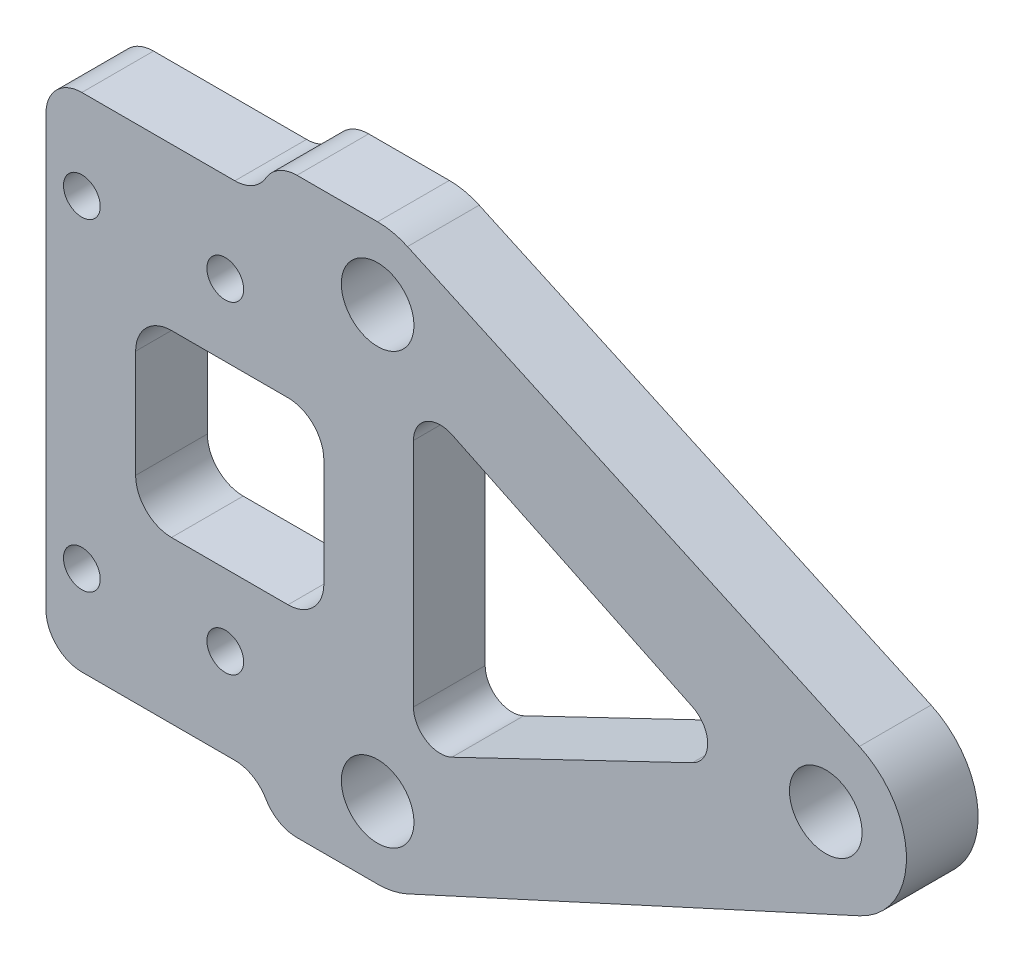
from build123d import *

# Parameters (mm, degrees)
SKETCH_1_W          = 48
SKETCH_1_H          = 32
EXTRUDE_1_DEPTH     = 4
SKETCH_2_R          = 2.025
SKETCH_2_R_2        = 1.025
CUT_EXTRUDE_1_DEPTH = 30.8
CUT_EXTRUDE_2_DEPTH = 10
SKETCH_5_W          = 12
SKETCH_5_H          = 2
CUT_EXTRUDE_3_DEPTH = 10
FILLET_1_R          = 2
CUT_EXTRUDE_4_DEPTH = 10
FILLET_2_R          = 1.5
SKETCH_7_W          = 10.5
SKETCH_7_H          = 10
CUT_EXTRUDE_5_DEPTH = 10
FILLET_3_R          = 2


with BuildPart() as part:
    # 草图1 → 凸台-拉伸1 (new body)
    with BuildSketch(Plane.XY):
        Rectangle(SKETCH_1_W, SKETCH_1_H)
    extrude(amount=EXTRUDE_1_DEPTH)

    # 草图2 → 切除-拉伸1 (cut)
    with BuildSketch(Plane(origin=(0, 0, 0), x_dir=(-1, 0, 0), z_dir=(0, 0, -1))):
        with Locations((-19.5, 0)):
            Circle(SKETCH_2_R)
        with Locations((5.5, -12)):
            Circle(SKETCH_2_R)
        with Locations((5.5, 12)):
            Circle(SKETCH_2_R)
        with Locations((14, -9)):
            Circle(SKETCH_2_R_2)
        with Locations((22, -9)):
            Circle(SKETCH_2_R_2)
    cut_extrude_1 = extrude(amount=-CUT_EXTRUDE_1_DEPTH, mode=Mode.SUBTRACT)

    # 草图4 → 切除-拉伸2 (cut)
    with BuildSketch(Plane(origin=(0, 0, 0), x_dir=(-1, 0, 0), z_dir=(0, 0, -1))):
        with BuildLine():
            Line((-21.373826305, 4.091304802), (3.834376618, 15.636715379))
            ThreePointArc((3.834376618, 15.636715379), (4.647609689, 15.908123688), (5.5, 16))
            Line((5.5, 16), (-24, 16))
            Line((-24, 16), (-24, 0))
            ThreePointArc((-24, 0), (-23.286965696, 2.430821017), (-21.373826305, 4.091304802))
        make_face()
    cut_extrude_2 = extrude(amount=-CUT_EXTRUDE_2_DEPTH, mode=Mode.SUBTRACT)

    # 镜向1: 切除-拉伸2 across plane
    add(cut_extrude_2.mirror(Plane.ZX), mode=Mode.SUBTRACT)

    # 草图5 → 切除-拉伸3 (cut)
    with BuildSketch(Plane(origin=(0, 0, 0), x_dir=(-1, 0, 0), z_dir=(0, 0, -1))):
        with Locations((18, -15)):
            Rectangle(SKETCH_5_W, SKETCH_5_H)
        with Locations((18, 15)):
            Rectangle(SKETCH_5_W, SKETCH_5_H)
    extrude(amount=-CUT_EXTRUDE_3_DEPTH, mode=Mode.SUBTRACT)

    # 圆角1
    fillet_1_edges = [part.edges().sort_by_distance(p)[0] for p in [
        (-24, -14, 2),
        (-24, 14, 2),
        (-12, -16, 2),
        (-12, 16, 2),
    ]]
    fillet(fillet_1_edges, radius=FILLET_1_R - 0.0001)  # a hair under: the kernel refuses the full size

    # 草图6 → 切除-拉伸4 (cut)
    with BuildSketch(Plane(origin=(0, 0, 0), x_dir=(-1, 0, 0), z_dir=(0, 0, -1))):
        Polygon((3.5, 8.82153206), (-14.878191792, 0), (3.5, -8.82153206), align=None)
    extrude(amount=-CUT_EXTRUDE_4_DEPTH, mode=Mode.SUBTRACT)

    # 圆角2
    fillet_2_edges = [part.edges().sort_by_distance(p)[0] for p in [
        (-3.5, 8.82153206, 2),
        (-3.5, -8.82153206, 2),
        (14.878191792, 0, 2),
    ]]
    fillet(fillet_2_edges, radius=FILLET_2_R)

    # 镜向2: 切除-拉伸1 across plane
    add(cut_extrude_1.mirror(Plane.ZX), mode=Mode.SUBTRACT)

    # 草图7 → 切除-拉伸5 (cut)
    with BuildSketch(Plane(origin=(0, 0, 0), x_dir=(-1, 0, 0), z_dir=(0, 0, -1))):
        with Locations((13.75, 0)):
            Rectangle(SKETCH_7_W, SKETCH_7_H)
    extrude(amount=-CUT_EXTRUDE_5_DEPTH, mode=Mode.SUBTRACT)

    # 圆角3
    fillet_3_edges = [part.edges().sort_by_distance(p)[0] for p in [
        (-19, 5, 2),
        (-19, -5, 2),
        (-8.5, -5, 2),
        (-8.5, 5, 2),
        (-12, -14, 2),
        (-12, 14, 2),
    ]]
    fillet(fillet_3_edges, radius=FILLET_3_R)


solid = part.part
